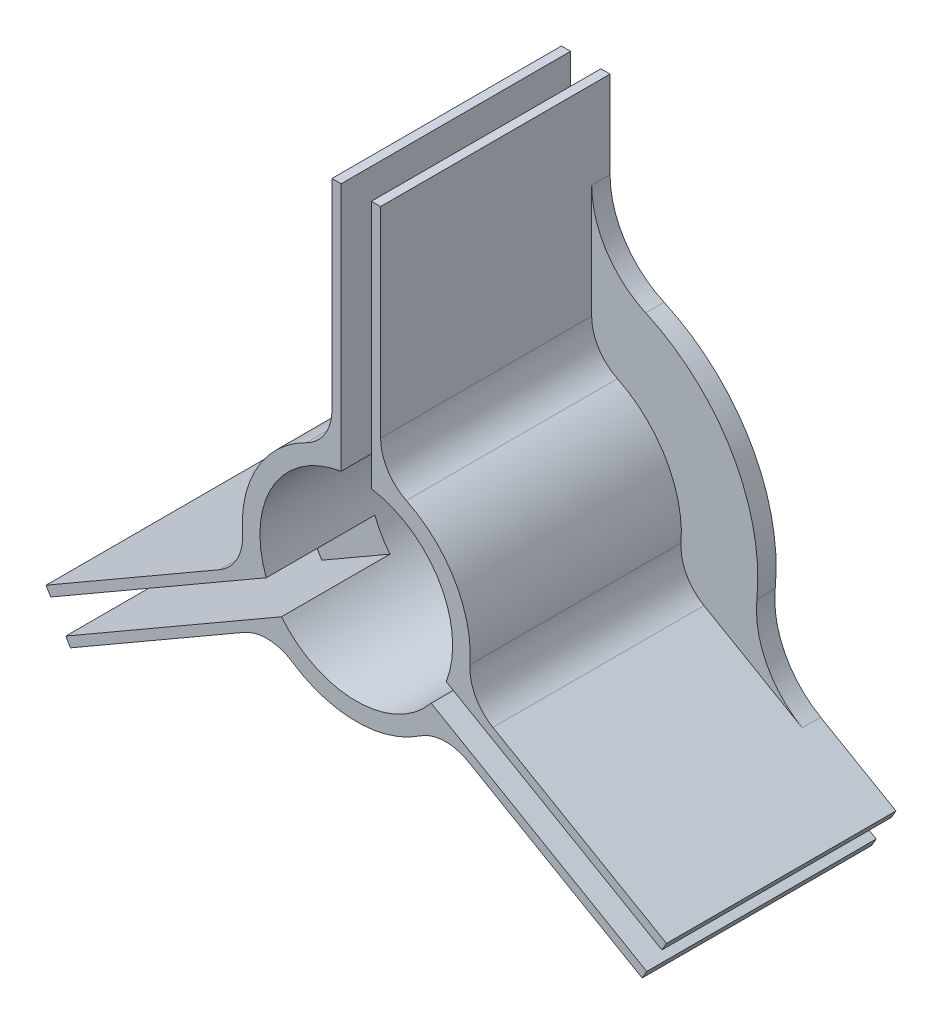
from build123d import *

# Parameters (mm, degrees)
SKETCH1_R                       = 20.75
BOSS_EXTRUDE1_DEPTH             = 50
BOSS_EXTRUDE2_DEPTH             = 3.2
THICKEN1_OUTLINE_R              = 24.85
THICKEN1_OUTLINE_R_2            = 20.85
THICKEN1_DEPTH                  = 50
THICKEN2_OUTLINE_W              = 2
THICKEN2_OUTLINE_H              = 37
THICKEN2_DEPTH                  = 50
THICKEN2_START                  = 26.35
THICKEN2_2_DEPTH                = 23.65
THICKEN3_OUTLINE_W              = 2
THICKEN3_OUTLINE_H              = 37
THICKEN3_DEPTH                  = 50
THICKEN3_START                  = 26.35
THICKEN3_2_DEPTH                = 23.65
BOSS_EXTRUDE4_REACH             = 95.501
SKETCH4_W                       = 26.35
SKETCH4_H                       = 17.15
BOSS_EXTRUDE4_DIRECTION_2_REACH = 95.501
FILLET1_R                       = 10
SKETCH3_R                       = 41.5
BOSS_EXTRUDE3_DEPTH             = 4
FILLET2_R                       = 20
CIRPATTERN4_COUNT               = 3
MOVE_FACE3_BY                   = 0.25
MOVE_FACE4_BY                   = 0.1
MOVE_FACE4_2_BY                 = 0.1
MOVE_FACE4_3_BY                 = 0.1
MOVE_START                      = 26.35
MOVE_FACE5_OUTLINE_W            = 6.6
MOVE_FACE5_OUTLINE_H            = 20.75
MOVE_FACE5_DEPTH                = 23.65
CIRPATTERN1_COUNT               = 3


with BuildPart() as part:
    # Sketch1 → Boss-Extrude1 (new body)
    with BuildSketch(Plane.XY):
        Circle(SKETCH1_R)
    extrude(amount=BOSS_EXTRUDE1_DEPTH)

    # Move Face3: a curved face moved outward by 0.25
    add(Solid.thicken(part.faces().sort_by_distance((-20.75, 0, 25))[0], MOVE_FACE3_BY))


with BuildPart() as body_2:
    # Sketch2 → Boss-Extrude2 (new, symmetric)
    with BuildSketch(Plane(origin=(0, 0, 0), x_dir=(0, 0, -1), z_dir=(1, 0, 0))):
        Polygon((-26.35, 20.75), (-26.35, 38), (0, 38), (0, 75), (-50, 75), (-50, 20.75), align=None)
    extrude(amount=BOSS_EXTRUDE2_DEPTH, both=True)

    # Move Face4: a face moved outward by 0.1
    extrude(body_2.faces().sort_by_distance((0, 38, 13.175))[0], amount=MOVE_FACE4_BY, dir=(0, -1, 0))

    # Move Face4 2: a face moved outward by 0.1
    extrude(body_2.faces().sort_by_distance((-3.2, 51.599129054, 27.380423031))[0], amount=MOVE_FACE4_2_BY, dir=(-1, 0, 0))

    # Move Face4 3: a face moved outward by 0.1
    extrude(body_2.faces().sort_by_distance((3.2, 51.599129054, 27.380423031))[0], amount=MOVE_FACE4_3_BY, dir=(1, 0, 0))

    # Move Face5: read off the stored shape, not the designer's step
    # Move Face5 outline → Move Face5 (add)
    with BuildSketch(Plane.XY.offset(MOVE_START)):
        with Locations((0, 10.375)):
            Rectangle(MOVE_FACE5_OUTLINE_W, MOVE_FACE5_OUTLINE_H)
    extrude(amount=MOVE_FACE5_DEPTH)


with BuildPart() as body_3:
    # Thicken1: read off the stored shape, not the designer's step
    # Thicken1 outline → Thicken1 (new body)
    with BuildSketch(Plane.XY):
        Circle(THICKEN1_OUTLINE_R)
        Circle(THICKEN1_OUTLINE_R_2, mode=Mode.SUBTRACT)
    extrude(amount=THICKEN1_DEPTH)

    # Thicken2: read off the stored shape, not the designer's step
    # Thicken2 outline → Thicken2 (add)
    with BuildSketch(Plane.XY):
        with Locations((-4.3, 56.5)):
            Rectangle(THICKEN2_OUTLINE_W, THICKEN2_OUTLINE_H)
    extrude(amount=THICKEN2_DEPTH)

    # Thicken2 2 outline → Thicken2 2 (add)
    with BuildSketch(Plane.XY.offset(THICKEN2_START)):
        with BuildLine():
            Line((-5.3, 38), (-5.3, 24.27823099))
            ThreePointArc((-5.3, 24.27823099), (-4.303593806, 24.474508787), (-3.3, 24.629910678))
            Line((-3.3, 24.629910678), (-3.3, 38))
            Line((-3.3, 38), (-5.3, 38))
        make_face()
    extrude(amount=THICKEN2_2_DEPTH)

    # Thicken3: read off the stored shape, not the designer's step
    # Thicken3 outline → Thicken3 (add)
    with BuildSketch(Plane.XY):
        with Locations((4.3, 56.5)):
            Rectangle(THICKEN3_OUTLINE_W, THICKEN3_OUTLINE_H)
    extrude(amount=THICKEN3_DEPTH)

    # Thicken3 2 outline → Thicken3 2 (add)
    with BuildSketch(Plane.XY.offset(THICKEN3_START)):
        with BuildLine():
            Line((5.3, 38), (3.3, 38))
            Line((3.3, 38), (3.3, 24.629910678))
            ThreePointArc((3.3, 24.629910678), (4.303593806, 24.474508787), (5.3, 24.27823099))
            Line((5.3, 24.27823099), (5.3, 38))
        make_face()
    extrude(amount=THICKEN3_2_DEPTH)

    # Boss-Extrude4: up to this face of the body (flat: up to its plane)
    boss_extrude4_end = Plane(body_3.part.faces().sort_by_distance((5.3, 52.715205781, 26.966203656))[0])
    # Sketch4 → Boss-Extrude4 (add, up to the picked face)
    with BuildSketch(Plane(origin=(0, 0, 0), x_dir=(0, 0, -1), z_dir=(1, 0, 0)), mode=Mode.PRIVATE) as boss_extrude4_sk1:
        with Locations((-13.175, 29.425)):
            Rectangle(SKETCH4_W, SKETCH4_H)
    boss_extrude4_tool1 = split(extrude(boss_extrude4_sk1.sketch, amount=BOSS_EXTRUDE4_REACH, mode=Mode.PRIVATE), bisect_by=boss_extrude4_end, keep=Keep.BOTH, mode=Mode.PRIVATE)
    add(boss_extrude4_tool1.solids().sort_by(Axis((0, 29.425, 13.175), (1, 0, 0)))[0])

    # Boss-Extrude4 direction 2: up to this face of the body (flat: up to its plane)
    boss_extrude4_direction_2_end = Plane(body_3.part.faces().sort_by_distance((-5.3, 52.715205781, 26.966203656))[0])
    # Sketch4 → Boss-Extrude4 direction 2 (add, up to the picked face)
    with BuildSketch(Plane(origin=(0, 0, 0), x_dir=(0, 0, -1), z_dir=(1, 0, 0)), mode=Mode.PRIVATE) as boss_extrude4_direction_2_sk1:
        with Locations((-13.175, 29.425)):
            Rectangle(SKETCH4_W, SKETCH4_H)
    boss_extrude4_direction_2_tool1 = split(extrude(boss_extrude4_direction_2_sk1.sketch, amount=-BOSS_EXTRUDE4_DIRECTION_2_REACH, mode=Mode.PRIVATE), bisect_by=boss_extrude4_direction_2_end, keep=Keep.BOTH, mode=Mode.PRIVATE)
    add(boss_extrude4_direction_2_tool1.solids().sort_by(Axis((0, 29.425, 13.175), (-1, 0, 0)))[0])

    # Fillet1
    fillet1_edges = [body_3.edges().sort_by_distance(p)[0] for p in [
        (-5.3, 24.27823099, 13.175),
        (5.3, 24.27823099, 13.175),
    ]]
    fillet(fillet1_edges, radius=FILLET1_R)

    # Sketch3 → Boss-Extrude3 (add)
    with BuildSketch(Plane.XY):
        Circle(SKETCH3_R)
    extrude(amount=BOSS_EXTRUDE3_DEPTH)

    # Fillet2
    fillet2_edges = [body_3.edges().sort_by_distance(p)[0] for p in [
        (-5.3, 41.160174927, 2),
        (5.3, 41.160174927, 2),
    ]]
    fillet(fillet2_edges, radius=FILLET2_R)


with BuildPart() as cirpattern4_1:
    # CirPattern4: pattern copy
    add(body_3.part.rotate(Axis((0, 0, 0), (0, 0, 1)), 1 * 360 / CIRPATTERN4_COUNT))


with BuildPart() as cirpattern4_2:
    # CirPattern4: pattern copy
    add(body_3.part.rotate(Axis((0, 0, 0), (0, 0, 1)), 2 * 360 / CIRPATTERN4_COUNT))

    # Combine2: read off the stored shape, not the designer's step
    # Combine2: union CirPattern4_1, body 3
    add(cirpattern4_1.part)
    add(body_3.part)


with BuildPart() as cirpattern1_1:
    # CirPattern1: pattern copy
    add(body_2.part.rotate(Axis((0, 0, 0), (0, 0, 1)), 1 * 360 / CIRPATTERN1_COUNT))


with BuildPart() as cirpattern1_2:
    # CirPattern1: pattern copy
    add(body_2.part.rotate(Axis((0, 0, 0), (0, 0, 1)), 2 * 360 / CIRPATTERN1_COUNT))


with BuildPart() as cirpattern4_2_1:
    add(cirpattern4_2.part)

    # Combine3: read off the stored shape, not the designer's step
    # Combine3: cut CirPattern1_2, CirPattern1_1, body 2, part
    add(cirpattern1_2.part, mode=Mode.SUBTRACT)
    add(cirpattern1_1.part, mode=Mode.SUBTRACT)
    add(body_2.part, mode=Mode.SUBTRACT)
    add(part.part, mode=Mode.SUBTRACT)


solid = cirpattern4_2_1.part
